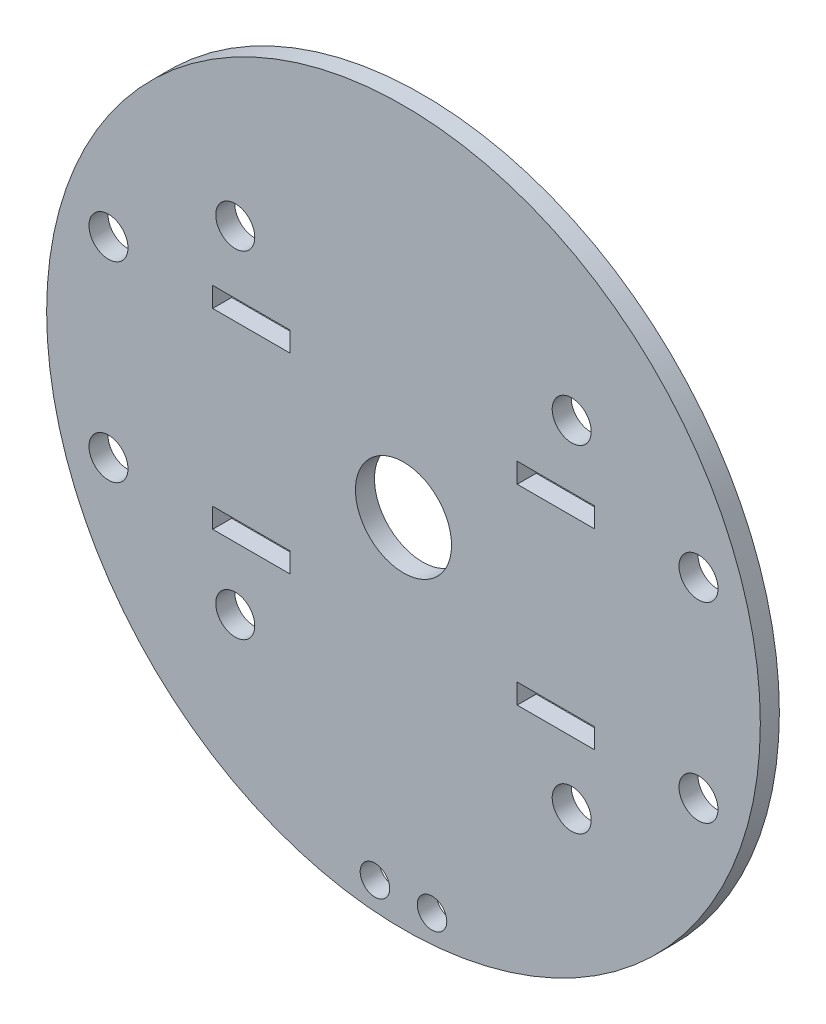
from build123d import *

# Parameters (mm, degrees)
SKETCH_1_R      = 37.5
SKETCH_1_R_2    = 5.05
SKETCH_1_R_3    = 1.55
SKETCH_1_R_4    = 2.05
SKETCH_1_W      = 8.1
SKETCH_1_H      = 2.1
EXTRUDE_1_DEPTH = 2


with BuildPart() as part:
    # 草图1 → 凸台-拉伸1 (new body)
    with BuildSketch(Plane.XY):
        Circle(SKETCH_1_R)
        Circle(SKETCH_1_R_2, mode=Mode.SUBTRACT)
        with Locations((-3, -34.5)):
            Circle(SKETCH_1_R_3, mode=Mode.SUBTRACT)
        with Locations((3, -34.5)):
            Circle(SKETCH_1_R_3, mode=Mode.SUBTRACT)
        with Locations((-17.67766953, -17.67766953)):
            Circle(SKETCH_1_R_4, mode=Mode.SUBTRACT)
        with Locations((-17.67766953, 17.67766953)):
            Circle(SKETCH_1_R_4, mode=Mode.SUBTRACT)
        with Locations((17.67766953, 17.67766953)):
            Circle(SKETCH_1_R_4, mode=Mode.SUBTRACT)
        with Locations((17.67766953, -17.67766953)):
            Circle(SKETCH_1_R_4, mode=Mode.SUBTRACT)
        with Locations((-31, -10.05)):
            Circle(SKETCH_1_R_4, mode=Mode.SUBTRACT)
        with Locations((-31, 10.05)):
            Circle(SKETCH_1_R_4, mode=Mode.SUBTRACT)
        with Locations((31, 10.05)):
            Circle(SKETCH_1_R_4, mode=Mode.SUBTRACT)
        with Locations((31, -10.05)):
            Circle(SKETCH_1_R_4, mode=Mode.SUBTRACT)
        with Locations((16, -10.05)):
            Rectangle(SKETCH_1_W, SKETCH_1_H, mode=Mode.SUBTRACT)
        with Locations((16, 10.05)):
            Rectangle(SKETCH_1_W, SKETCH_1_H, mode=Mode.SUBTRACT)
        with Locations((-16, 10.05)):
            Rectangle(SKETCH_1_W, SKETCH_1_H, mode=Mode.SUBTRACT)
        with Locations((-16, -10.05)):
            Rectangle(SKETCH_1_W, SKETCH_1_H, mode=Mode.SUBTRACT)
    extrude(amount=EXTRUDE_1_DEPTH)


solid = part.part
